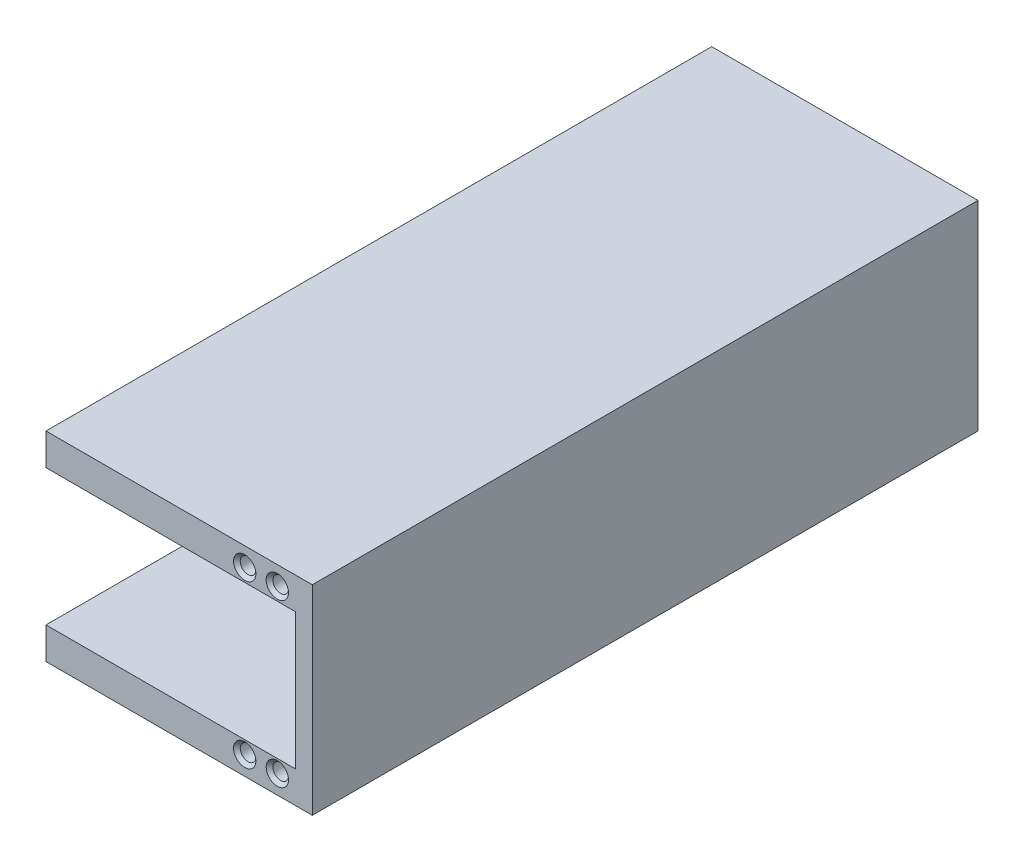
from build123d import *

# Parameters (mm, degrees)
BOSS_EXTRUDE1_DEPTH = 200
SKETCH2_R           = 2.35
CUT_EXTRUDE1_DEPTH  = 8
CUT_EXTRUDE2_START  = -8
SKETCH3_R           = 2.35
CUT_EXTRUDE2_DEPTH  = 8
CHAMFER1_SIZE       = 1


with BuildPart() as part:
    # Sketch1 → Boss-Extrude1 (new body)
    with BuildSketch(Plane.XY):
        Polygon((-40, 30), (40, 30), (40, -30), (-40, -30), (-40, -20.45), (35, -20.45), (35, 20.45), (-40, 20.45), align=None)
    extrude(amount=BOSS_EXTRUDE1_DEPTH)

    # Sketch2 → Cut-Extrude1 (cut)
    with BuildSketch(Plane.XY.offset(200)):
        with Locations((29.5, 24.34)):
            Circle(SKETCH2_R)
        with Locations((19.7, 24.34)):
            Circle(SKETCH2_R)
        with Locations((19.7, -24.34)):
            Circle(SKETCH2_R)
        with Locations((29.5, -24.34)):
            Circle(SKETCH2_R)
    extrude(amount=-CUT_EXTRUDE1_DEPTH, mode=Mode.SUBTRACT)

    # Sketch3 → Cut-Extrude2 (cut)
    with BuildSketch(Plane(origin=(0, 0, 0), x_dir=(-1, 0, 0), z_dir=(0, 0, -1)).offset(CUT_EXTRUDE2_START)):
        with Locations((-29.5, 24.34)):
            Circle(SKETCH3_R)
        with Locations((-19.7, 24.34)):
            Circle(SKETCH3_R)
        with Locations((-19.7, -24.34)):
            Circle(SKETCH3_R)
        with Locations((-29.5, -24.34)):
            Circle(SKETCH3_R)
    extrude(amount=CUT_EXTRUDE2_DEPTH, mode=Mode.SUBTRACT)

    # Chamfer1
    chamfer1_edges = [part.edges().sort_by_distance(p)[0] for p in [
        (22.05, -24.34, 0),
        (31.85, -24.34, 0),
        (31.85, 24.34, 0),
        (22.05, 24.34, 0),
        (27.15, -24.34, 200),
        (17.35, -24.34, 200),
        (17.35, 24.34, 200),
        (27.15, 24.34, 200),
    ]]
    chamfer(chamfer1_edges, length=CHAMFER1_SIZE)


solid = part.part
